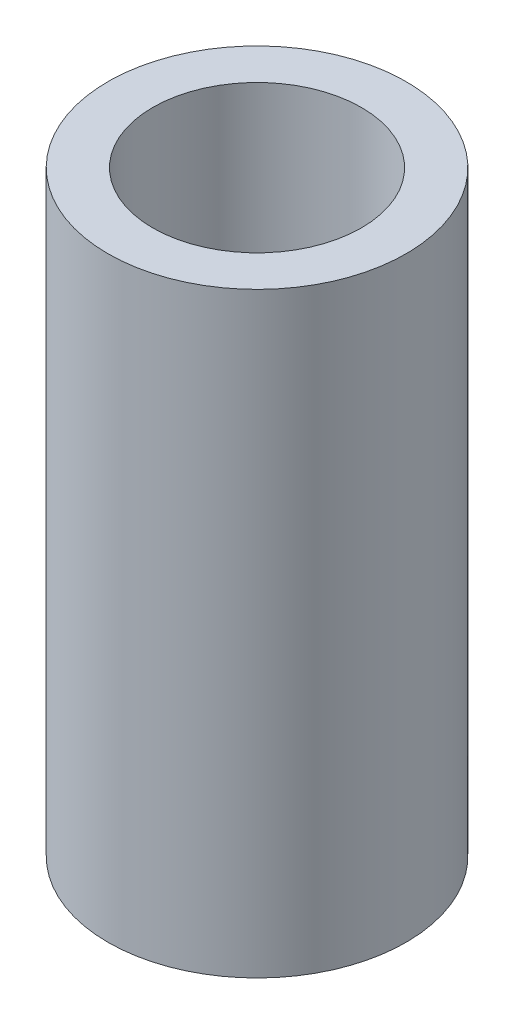
from build123d import *

# Parameters (mm, degrees)
SKETCH1_R           = 2.5
SKETCH1_R_2         = 1.75
BOSS_EXTRUDE1_DEPTH = 10


with BuildPart() as part:
    # Sketch1 → Boss-Extrude1 (new body)
    with BuildSketch(Plane(origin=(0, 0, 0), x_dir=(1, 0, 0), z_dir=(0, 1, 0))):
        Circle(SKETCH1_R)
        Circle(SKETCH1_R_2, mode=Mode.SUBTRACT)
    extrude(amount=BOSS_EXTRUDE1_DEPTH)


solid = part.part
